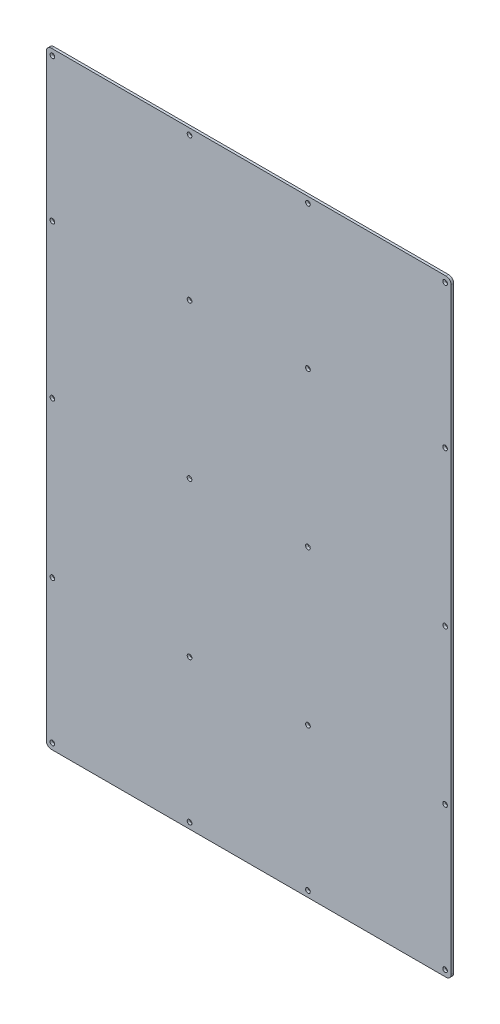
from build123d import *

# Parameters (mm, degrees)
SKETCH1_W           = 254
SKETCH1_H           = 381
BOSS_EXTRUDE1_DEPTH = 1.5875
SKETCH2_R           = 1.4732
CUT_EXTRUDE1_DEPTH  = 458.907763809
FILLET1_R           = 3.175


with BuildPart() as part:
    # Sketch1 → Boss-Extrude1 (new body)
    with BuildSketch(Plane.XY):
        with Locations((127, 190.5)):
            Rectangle(SKETCH1_W, SKETCH1_H)
    extrude(amount=BOSS_EXTRUDE1_DEPTH)

    # Sketch2 → Cut-Extrude1 (cut, through all)
    with BuildSketch(Plane.XY.offset(1.5875)):
        with Locations((3.81, 377.19)):
            Circle(SKETCH2_R)
        with Locations((89.8652, 377.19)):
            Circle(SKETCH2_R)
        with Locations((164.1348, 377.19)):
            Circle(SKETCH2_R)
        with Locations((250.19, 377.19)):
            Circle(SKETCH2_R)
        with Locations((164.1348, 287.375451288)):
            Circle(SKETCH2_R)
        with Locations((3.81, 287.3756)):
            Circle(SKETCH2_R)
        with Locations((250.19, 287.3756)):
            Circle(SKETCH2_R)
        with Locations((89.8652, 287.3756)):
            Circle(SKETCH2_R)
        with Locations((164.1348, 190.499990436)):
            Circle(SKETCH2_R)
        with Locations((3.81, 191.135)):
            Circle(SKETCH2_R)
        with Locations((250.19, 190.5)):
            Circle(SKETCH2_R)
        with Locations((89.8652, 190.5)):
            Circle(SKETCH2_R)
        with Locations((164.1348, 93.6244)):
            Circle(SKETCH2_R)
        with Locations((3.81, 93.6244)):
            Circle(SKETCH2_R)
        with Locations((250.19, 93.6244)):
            Circle(SKETCH2_R)
        with Locations((89.8652, 93.6244)):
            Circle(SKETCH2_R)
        with Locations((164.1348, 3.81)):
            Circle(SKETCH2_R)
        with Locations((3.81, 3.81)):
            Circle(SKETCH2_R)
        with Locations((250.19, 3.81)):
            Circle(SKETCH2_R)
        with Locations((89.8652, 3.81)):
            Circle(SKETCH2_R)
    extrude(amount=-CUT_EXTRUDE1_DEPTH, mode=Mode.SUBTRACT)

    # Fillet1
    fillet1_edges = [part.edges().sort_by_distance(p)[0] for p in [
        (254, 0, 0.79375),
        (0, 0, 0.79375),
        (254, 381, 0.79375),
        (0, 381, 0.79375),
    ]]
    fillet(fillet1_edges, radius=FILLET1_R)


solid = part.part
